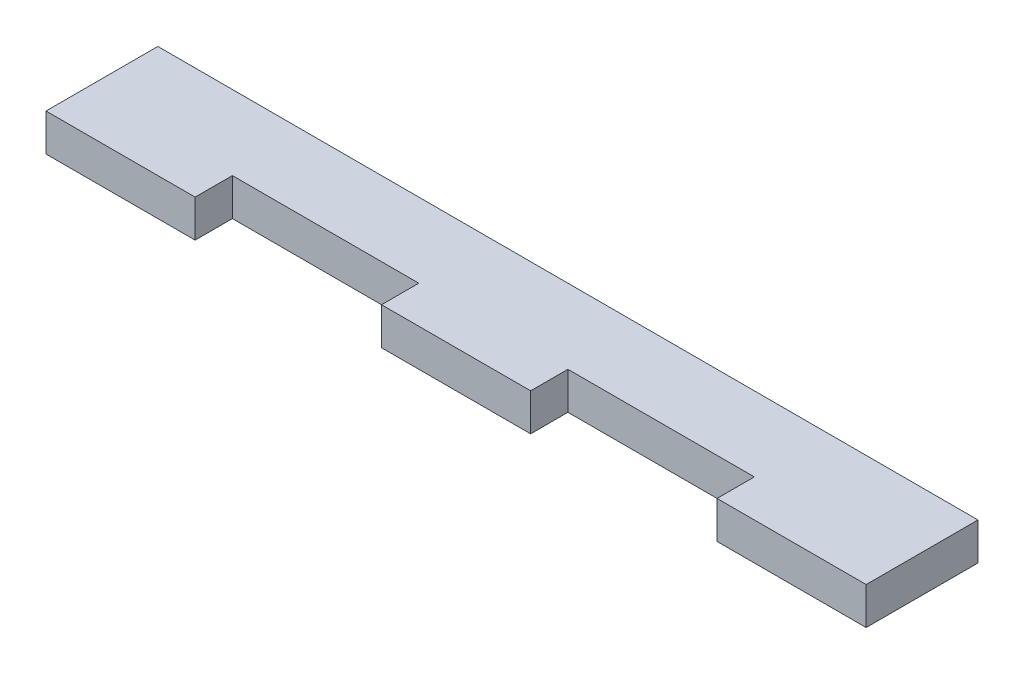
from build123d import *

# Parameters (mm, degrees)
BOSS_EXTRUDE1_DEPTH = 6.35


with BuildPart() as part:
    # Sketch1 → Boss-Extrude1 (new body)
    with BuildSketch(Plane(origin=(0, 0, 0), x_dir=(1, 0, 0), z_dir=(0, 1, 0))):
        Polygon((-12.7, -6.35), (-12.7, -12.7), (12.7, -12.7), (12.7, -6.35), (44.45, -6.35), (44.45, -12.7), (69.85, -12.7), (69.85, -6.35), (69.85, 6.35), (-69.85, 6.35), (-69.85, -6.35), (-69.85, -12.7), (-44.45, -12.7), (-44.45, -6.35), align=None)
    extrude(amount=BOSS_EXTRUDE1_DEPTH)


solid = part.part
